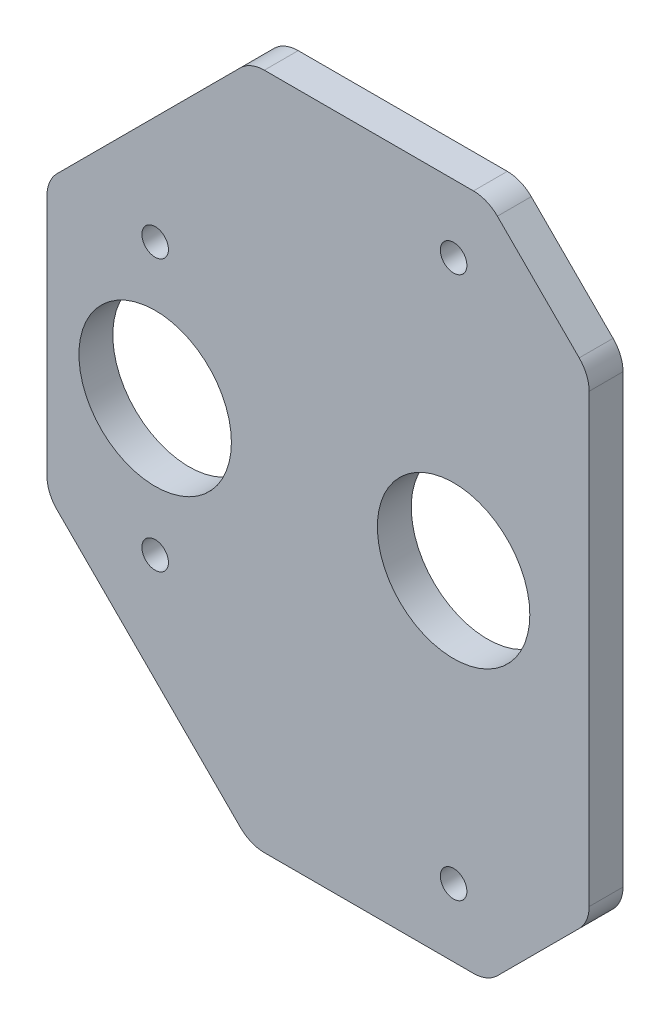
from build123d import *

# Parameters (mm, degrees)
SKETCH1_W           = 101.6
SKETCH1_H           = 127
SKETCH1_R           = 2.4892
SKETCH1_R_2         = 14.2875
BOSS_EXTRUDE1_DEPTH = 3.175
CHAMFER2_SIZE       = 38.1
CHAMFER3_SIZE       = 19.05
FILLET2_R           = 6.35


with BuildPart() as part:
    # Sketch1 → Boss-Extrude1 (new, symmetric)
    with BuildSketch(Plane.XY):
        with Locations((50.8, 63.5)):
            Rectangle(SKETCH1_W, SKETCH1_H)
        with Locations((20.2692, 88.9)):
            Circle(SKETCH1_R, mode=Mode.SUBTRACT)
        with Locations((20.2692, 63.5)):
            Circle(SKETCH1_R_2, mode=Mode.SUBTRACT)
        with Locations((20.2692, 38.1)):
            Circle(SKETCH1_R, mode=Mode.SUBTRACT)
        with Locations((76.2, 114.3)):
            Circle(SKETCH1_R, mode=Mode.SUBTRACT)
        with Locations((76.2, 63.5)):
            Circle(SKETCH1_R_2, mode=Mode.SUBTRACT)
        with Locations((76.2, 12.7)):
            Circle(SKETCH1_R, mode=Mode.SUBTRACT)
    extrude(amount=BOSS_EXTRUDE1_DEPTH, both=True)

    # Chamfer2
    chamfer2_edges = [part.edges().sort_by_distance(p)[0] for p in [
        (0, 0, 0),
        (0, 127, 0),
    ]]
    chamfer(chamfer2_edges, length=CHAMFER2_SIZE)

    # Chamfer3
    chamfer3_edges = [part.edges().sort_by_distance(p)[0] for p in [
        (101.6, 0, 0),
        (101.6, 127, 0),
    ]]
    chamfer(chamfer3_edges, length=CHAMFER3_SIZE)

    # Fillet2
    fillet2_edges = [part.edges().sort_by_distance(p)[0] for p in [
        (101.6, 107.95, 0),
        (82.55, 127, 0),
        (0, 88.9, 0),
        (0, 38.1, 0),
        (38.1, 0, 0),
        (82.55, 0, 0),
        (101.6, 19.05, 0),
        (38.1, 127, 0),
    ]]
    fillet(fillet2_edges, radius=FILLET2_R)


solid = part.part
